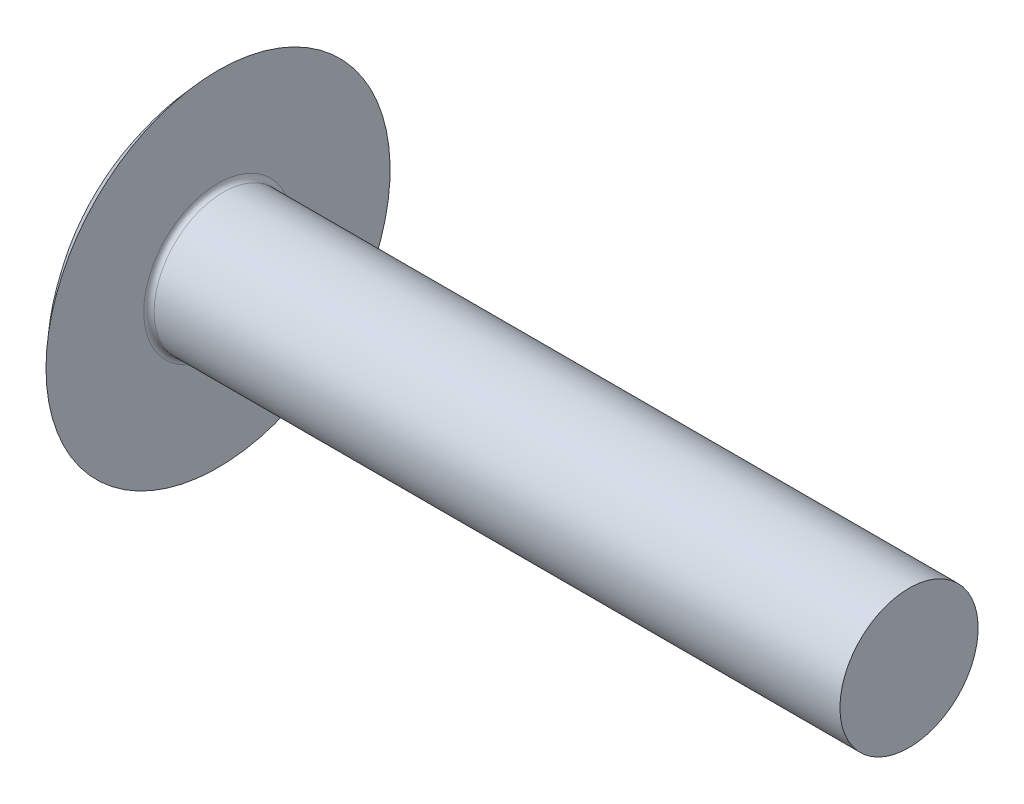
from build123d import *


with BuildPart() as part:
    # Sketch1 → Base-Revolve (revolve)
    with BuildSketch(Plane.XY):
        with BuildLine():
            Line((43.962049535, 0), (43.962049535, 4))
            Line((43.962049535, 4), (4.262049535, 4))
            ThreePointArc((4.262049535, 4), (4.049917501, 4.087867966), (3.962049535, 4.3))
            Line((3.962049535, 4.3), (3.962049535, 9.96))
            ThreePointArc((3.962049535, 9.96), (1.026873382, 5.359557736), (0, 0))
            Line((0, 0), (43.962049535, 0))
        make_face()
    revolve(axis=Axis((-60.094413408, 0, 0), (1, 0, 0)))


solid = part.part
